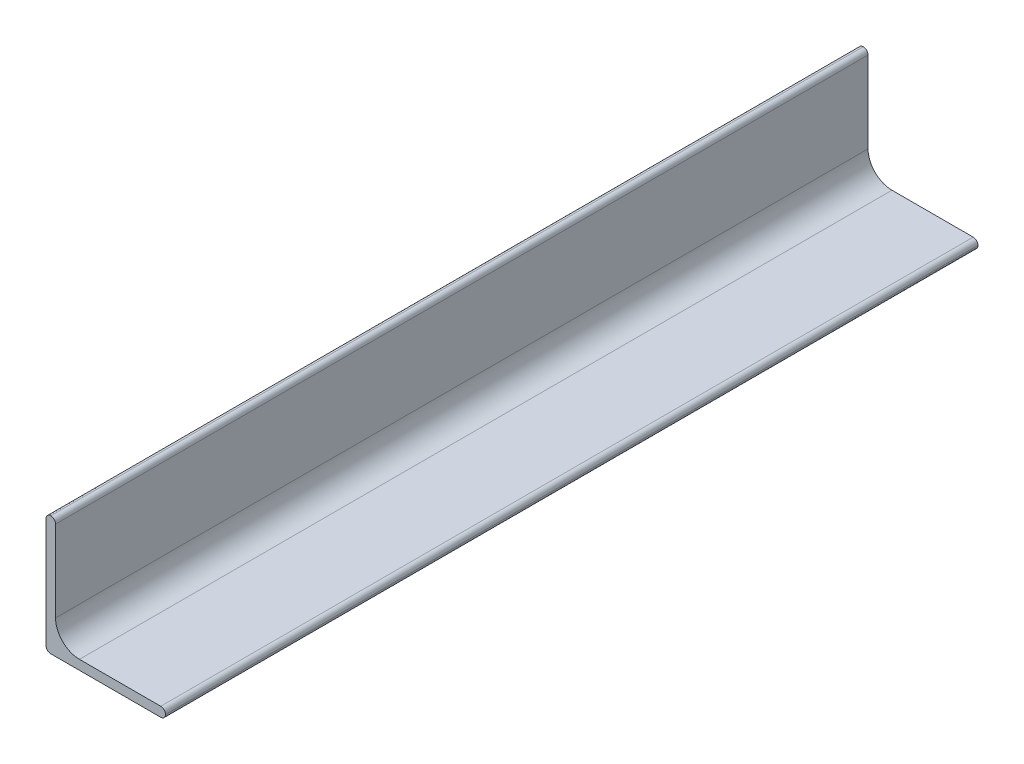
from build123d import *

# Parameters (mm, degrees)
EXTRUDE_1_DEPTH = 170
FILLET_1_R      = 1


with BuildPart() as part:
    # 草图1 → 凸台-拉伸1 (new body)
    with BuildSketch(Plane.XY):
        with BuildLine():
            Line((0, 0), (25, 0))
            Line((25, 0), (25, 2))
            Line((25, 2), (7, 2))
            ThreePointArc((7, 2), (3.464466094, 3.464466094), (2, 7))
            Line((2, 7), (2, 25))
            Line((2, 25), (0, 25))
            Line((0, 25), (0, 0))
        make_face()
    extrude(amount=EXTRUDE_1_DEPTH)

    # 圆角1
    fillet_1_edges = [part.edges().sort_by_distance(p)[0] for p in [
        (0, 25, 85),
        (25, 2, 85),
        (25, 0, 85),
        (0, 0, 85),
        (2, 25, 85),
    ]]
    fillet(fillet_1_edges, radius=FILLET_1_R - 0.0001)  # a hair under: the kernel refuses the full size


solid = part.part
